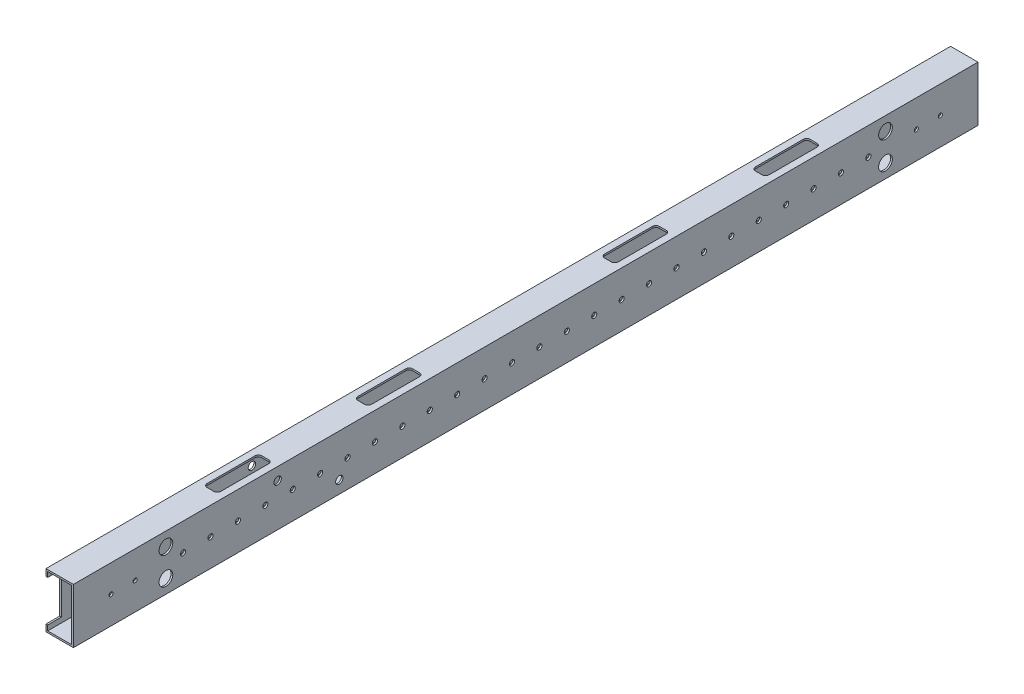
from build123d import *

# Parameters (mm, degrees)
SKETCH1_W           = 25.4
SKETCH1_H           = 50.8
SKETCH1_W_2         = 22.225
SKETCH1_H_2         = 47.625
BOSS_EXTRUDE1_DEPTH = 838.2
SKETCH2_R           = 3.175
SKETCH2_R_2         = 1.905
CUT_EXTRUDE1_DEPTH  = 839.969343898
CUT_EXTRUDE2_REACH  = 840.969
SKETCH3_R           = 6.35
SKETCH4_W           = 12.7
SKETCH4_H           = 38.1
CUT_EXTRUDE3_DEPTH  = 3.175
SKETCH5_R           = 2.38125
CUT_EXTRUDE4_DEPTH  = 839.969343898
CUT_EXTRUDE5_DEPTH  = 279.4
CUT_EXTRUDE6_DEPTH  = 3.175
SKETCH10_R          = 3.429
CUT_EXTRUDE7_DEPTH  = 839.969343898


with BuildPart() as part:
    # Sketch1 → Boss-Extrude1 (new body)
    with BuildSketch(Plane.XY):
        Rectangle(SKETCH1_W, SKETCH1_H)
        Rectangle(SKETCH1_W_2, SKETCH1_H_2, mode=Mode.SUBTRACT)
    extrude(amount=BOSS_EXTRUDE1_DEPTH)

    # Sketch2 → Cut-Extrude1 (cut, through all)
    with BuildSketch(Plane(origin=(12.7, 0, 0), x_dir=(0, 0, -1), z_dir=(1, 0, 0))):
        with Locations((-85.725, 12.7)):
            Circle(SKETCH2_R)
        with Locations((-85.725, -12.7)):
            Circle(SKETCH2_R)
        with Locations((-752.475, 12.7)):
            Circle(SKETCH2_R)
        with Locations((-752.475, -12.7)):
            Circle(SKETCH2_R)
        with Locations((-57.15, 0)):
            Circle(SKETCH2_R_2)
        with Locations((-34.798, 0)):
            Circle(SKETCH2_R_2)
        with Locations((-803.402, 0)):
            Circle(SKETCH2_R_2)
        with Locations((-781.05, 0)):
            Circle(SKETCH2_R_2)
    extrude(amount=-CUT_EXTRUDE1_DEPTH, mode=Mode.SUBTRACT)

    # Sketch3 → Cut-Extrude2 (cut, up to next)
    with BuildSketch(Plane(origin=(12.7, 0, 0), x_dir=(0, 0, -1), z_dir=(1, 0, 0)), mode=Mode.PRIVATE) as cut_extrude2_sk1:
        with Locations((-752.475, 12.7)):
            Circle(SKETCH3_R)
    cut_extrude2_tool1 = extrude(cut_extrude2_sk1.sketch, amount=-CUT_EXTRUDE2_REACH, mode=Mode.PRIVATE) & part.part
    # Sketch3 → Cut-Extrude2 (cut, up to next)
    with BuildSketch(Plane(origin=(12.7, 0, 0), x_dir=(0, 0, -1), z_dir=(1, 0, 0)), mode=Mode.PRIVATE) as cut_extrude2_sk2:
        with Locations((-752.475, -12.7)):
            Circle(SKETCH3_R)
    cut_extrude2_tool2 = extrude(cut_extrude2_sk2.sketch, amount=-CUT_EXTRUDE2_REACH, mode=Mode.PRIVATE) & part.part
    # Sketch3 → Cut-Extrude2 (cut, up to next)
    with BuildSketch(Plane(origin=(12.7, 0, 0), x_dir=(0, 0, -1), z_dir=(1, 0, 0)), mode=Mode.PRIVATE) as cut_extrude2_sk3:
        with Locations((-85.725, 12.7)):
            Circle(SKETCH3_R)
    cut_extrude2_tool3 = extrude(cut_extrude2_sk3.sketch, amount=-CUT_EXTRUDE2_REACH, mode=Mode.PRIVATE) & part.part
    # Sketch3 → Cut-Extrude2 (cut, up to next)
    with BuildSketch(Plane(origin=(12.7, 0, 0), x_dir=(0, 0, -1), z_dir=(1, 0, 0)), mode=Mode.PRIVATE) as cut_extrude2_sk4:
        with Locations((-85.725, -12.7)):
            Circle(SKETCH3_R)
    cut_extrude2_tool4 = extrude(cut_extrude2_sk4.sketch, amount=-CUT_EXTRUDE2_REACH, mode=Mode.PRIVATE) & part.part
    add(cut_extrude2_tool1.solids().sort_by_distance((12.7, 12.7, 752.475))[0], mode=Mode.SUBTRACT)
    add(cut_extrude2_tool2.solids().sort_by_distance((12.7, -12.7, 752.475))[0], mode=Mode.SUBTRACT)
    add(cut_extrude2_tool3.solids().sort_by_distance((12.7, 12.7, 85.725))[0], mode=Mode.SUBTRACT)
    add(cut_extrude2_tool4.solids().sort_by_distance((12.7, -12.7, 85.725))[0], mode=Mode.SUBTRACT)

    # Sketch4 → Cut-Extrude3 (cut)
    with BuildSketch(Plane.ZY.offset(12.7)):
        with Locations((6.35, 0)):
            Rectangle(SKETCH4_W, SKETCH4_H)
        with Locations((831.85, 0)):
            Rectangle(SKETCH4_W, SKETCH4_H)
    extrude(amount=-CUT_EXTRUDE3_DEPTH, mode=Mode.SUBTRACT)

    # Sketch5 → Cut-Extrude4 (cut, through all)
    with BuildSketch(Plane(origin=(12.7, 0, 0), x_dir=(0, 0, -1), z_dir=(1, 0, 0))):
        with Locations((-736.6, 0)):
            Circle(SKETCH5_R)
        with Locations((-711.2, 0)):
            Circle(SKETCH5_R)
        with Locations((-685.8, 0)):
            Circle(SKETCH5_R)
        with Locations((-660.4, 0)):
            Circle(SKETCH5_R)
        with Locations((-635, 0)):
            Circle(SKETCH5_R)
        with Locations((-609.6, 0)):
            Circle(SKETCH5_R)
        with Locations((-584.2, 0)):
            Circle(SKETCH5_R)
        with Locations((-558.8, 0)):
            Circle(SKETCH5_R)
        with Locations((-533.4, 0)):
            Circle(SKETCH5_R)
        with Locations((-508, 0)):
            Circle(SKETCH5_R)
        with Locations((-482.6, 0)):
            Circle(SKETCH5_R)
        with Locations((-457.2, 0)):
            Circle(SKETCH5_R)
        with Locations((-431.8, 0)):
            Circle(SKETCH5_R)
        with Locations((-406.4, 0)):
            Circle(SKETCH5_R)
        with Locations((-381, 0)):
            Circle(SKETCH5_R)
        with Locations((-355.6, 0)):
            Circle(SKETCH5_R)
        with Locations((-330.2, 0)):
            Circle(SKETCH5_R)
        with Locations((-304.8, 0)):
            Circle(SKETCH5_R)
        with Locations((-279.4, 0)):
            Circle(SKETCH5_R)
        with Locations((-254, 0)):
            Circle(SKETCH5_R)
        with Locations((-228.6, 0)):
            Circle(SKETCH5_R)
        with Locations((-203.2, 0)):
            Circle(SKETCH5_R)
        with Locations((-177.8, 0)):
            Circle(SKETCH5_R)
        with Locations((-152.4, 0)):
            Circle(SKETCH5_R)
        with Locations((-127, 0)):
            Circle(SKETCH5_R)
        with Locations((-101.6, 0)):
            Circle(SKETCH5_R)
    extrude(amount=-CUT_EXTRUDE4_DEPTH, mode=Mode.SUBTRACT)

    # Sketch6 → Cut-Extrude5 (cut)
    with BuildSketch(Plane(origin=(0, 25.4, 0), x_dir=(1, 0, 0), z_dir=(0, 1, 0))):
        with BuildLine():
            Line((-3.175, -279.4), (3.175, -279.4))
            ThreePointArc((3.175, -279.4), (5.42006403, -280.32993597), (6.35, -282.575))
            Line((6.35, -282.575), (6.35, -327.025))
            ThreePointArc((6.35, -327.025), (5.42006403, -329.27006403), (3.175, -330.2))
            Line((3.175, -330.2), (-3.175, -330.2))
            ThreePointArc((-3.175, -330.2), (-5.42006403, -329.27006403), (-6.35, -327.025))
            Line((-6.35, -327.025), (-6.35, -282.575))
            ThreePointArc((-6.35, -282.575), (-5.42006403, -280.32993597), (-3.175, -279.4))
        make_face()
        with BuildLine():
            Line((6.35, -555.625), (6.35, -511.175))
            ThreePointArc((6.35, -511.175), (5.42006403, -508.92993597), (3.175, -508))
            Line((3.175, -508), (-3.175, -508))
            ThreePointArc((-3.175, -508), (-5.42006403, -508.92993597), (-6.35, -511.175))
            Line((-6.35, -511.175), (-6.35, -555.625))
            ThreePointArc((-6.35, -555.625), (-5.42006403, -557.87006403), (-3.175, -558.8))
            Line((-3.175, -558.8), (3.175, -558.8))
            ThreePointArc((3.175, -558.8), (5.42006403, -557.87006403), (6.35, -555.625))
        make_face()
        with BuildLine():
            Line((6.35, -695.325), (6.35, -650.875))
            ThreePointArc((6.35, -650.875), (5.42006403, -648.62993597), (3.175, -647.7))
            Line((3.175, -647.7), (-3.175, -647.7))
            ThreePointArc((-3.175, -647.7), (-5.42006403, -648.62993597), (-6.35, -650.875))
            Line((-6.35, -650.875), (-6.35, -695.325))
            ThreePointArc((-6.35, -695.325), (-5.42006403, -697.57006403), (-3.175, -698.5))
            Line((-3.175, -698.5), (3.175, -698.5))
            ThreePointArc((3.175, -698.5), (5.42006403, -697.57006403), (6.35, -695.325))
        make_face()
        with BuildLine():
            Line((-3.175, -139.7), (3.175, -139.7))
            ThreePointArc((3.175, -139.7), (5.42006403, -140.62993597), (6.35, -142.875))
            Line((6.35, -142.875), (6.35, -187.325))
            ThreePointArc((6.35, -187.325), (5.42006403, -189.57006403), (3.175, -190.5))
            Line((3.175, -190.5), (-3.175, -190.5))
            ThreePointArc((-3.175, -190.5), (-5.42006403, -189.57006403), (-6.35, -187.325))
            Line((-6.35, -187.325), (-6.35, -142.875))
            ThreePointArc((-6.35, -142.875), (-5.42006403, -140.62993597), (-3.175, -139.7))
        make_face()
    extrude(amount=-CUT_EXTRUDE5_DEPTH, mode=Mode.SUBTRACT)

    # Sketch9 → Cut-Extrude6 (cut)
    with BuildSketch(Plane.XZ.offset(25.4)):
        with BuildLine():
            Line((3.175, 533.4), (-3.175, 533.4))
            ThreePointArc((-3.175, 533.4), (-5.42006403, 532.47006403), (-6.35, 530.225))
            Line((-6.35, 530.225), (-6.35, 485.775))
            ThreePointArc((-6.35, 485.775), (-5.42006403, 483.52993597), (-3.175, 482.6))
            Line((-3.175, 482.6), (3.175, 482.6))
            ThreePointArc((3.175, 482.6), (5.42006403, 483.52993597), (6.35, 485.775))
            Line((6.35, 485.775), (6.35, 530.225))
            ThreePointArc((6.35, 530.225), (5.42006403, 532.47006403), (3.175, 533.4))
        make_face()
        with BuildLine():
            Line((-6.35, 307.975), (-6.35, 352.425))
            ThreePointArc((-6.35, 352.425), (-5.42006403, 354.67006403), (-3.175, 355.6))
            Line((-3.175, 355.6), (3.175, 355.6))
            ThreePointArc((3.175, 355.6), (5.42006403, 354.67006403), (6.35, 352.425))
            Line((6.35, 352.425), (6.35, 307.975))
            ThreePointArc((6.35, 307.975), (5.42006403, 305.72993597), (3.175, 304.8))
            Line((3.175, 304.8), (-3.175, 304.8))
            ThreePointArc((-3.175, 304.8), (-5.42006403, 305.72993597), (-6.35, 307.975))
        make_face()
    extrude(amount=-CUT_EXTRUDE6_DEPTH, mode=Mode.SUBTRACT)

    # Sketch10 → Cut-Extrude7 (cut, through all)
    with BuildSketch(Plane.ZY.offset(12.7)):
        with Locations((648.97, 13.97)):
            Circle(SKETCH10_R)
        with Locations((591.82, -13.97)):
            Circle(SKETCH10_R)
    extrude(amount=-CUT_EXTRUDE7_DEPTH, mode=Mode.SUBTRACT)


solid = part.part
